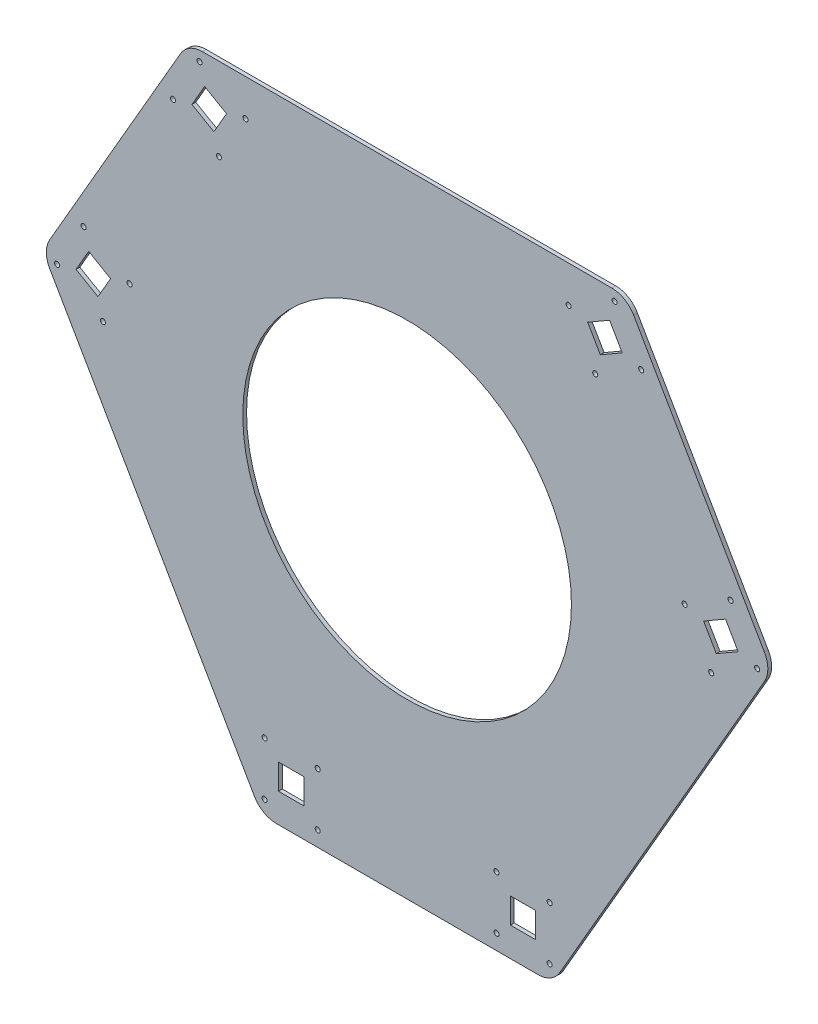
from build123d import *

# Parameters (mm, degrees)
SKETCH_1_R          = 2
SKETCH_1_R_2        = 130
EXTRUDE_1_DEPTH     = 3
SKETCH_8_W          = 20
SKETCH_8_H          = 20
CUT_EXTRUDE_4_DEPTH = 393.831948596
FILLET_2_R          = 20


with BuildPart() as part:
    # 草图1 → 凸台-拉伸1 (new body)
    with BuildSketch(Plane.XY):
        Polygon((288.439380774, 33.739992221), (173.439380774, 232.925835092), (-173.439380774, 232.925835092), (-288.439380774, 33.739992221), (-115, -266.665827313), (115, -266.665827313), align=None)
        with Locations((-112.720943809, -254.665736771)):
            Circle(SKETCH_1_R, mode=Mode.SUBTRACT)
        with Locations((-112.720943809, -212.665736771)):
            Circle(SKETCH_1_R, mode=Mode.SUBTRACT)
        with Locations((-70.720943809, -254.665736771)):
            Circle(SKETCH_1_R, mode=Mode.SUBTRACT)
        with Locations((-70.720943809, -212.665736771)):
            Circle(SKETCH_1_R, mode=Mode.SUBTRACT)
        with Locations((70.720943809, -254.665736771)):
            Circle(SKETCH_1_R, mode=Mode.SUBTRACT)
        with Locations((70.720943809, -212.665736771)):
            Circle(SKETCH_1_R, mode=Mode.SUBTRACT)
        with Locations((112.720943809, -254.665736771)):
            Circle(SKETCH_1_R, mode=Mode.SUBTRACT)
        with Locations((112.720943809, -212.665736771)):
            Circle(SKETCH_1_R, mode=Mode.SUBTRACT)
        with Locations((-240.534402462, 8.713667509)):
            Circle(SKETCH_1_R, mode=Mode.SUBTRACT)
        with Locations((-276.907469421, 29.713667509)):
            Circle(SKETCH_1_R, mode=Mode.SUBTRACT)
        with Locations((-219.534402462, 45.086734468)):
            Circle(SKETCH_1_R, mode=Mode.SUBTRACT)
        with Locations((-255.907469421, 66.086734468)):
            Circle(SKETCH_1_R, mode=Mode.SUBTRACT)
        with Locations((-148.813458654, 167.579002304)):
            Circle(SKETCH_1_R, mode=Mode.SUBTRACT)
        with Locations((-185.186525613, 188.579002304)):
            Circle(SKETCH_1_R, mode=Mode.SUBTRACT)
        with Locations((-164.186525613, 224.952069262)):
            Circle(SKETCH_1_R, mode=Mode.SUBTRACT)
        with Locations((-127.813458654, 203.952069262)):
            Circle(SKETCH_1_R, mode=Mode.SUBTRACT)
        Circle(SKETCH_1_R_2, mode=Mode.SUBTRACT)
        with Locations((240.534402462, 8.713667509)):
            Circle(SKETCH_1_R, mode=Mode.SUBTRACT)
        with Locations((219.534402462, 45.086734468)):
            Circle(SKETCH_1_R, mode=Mode.SUBTRACT)
        with Locations((276.907469421, 29.713667509)):
            Circle(SKETCH_1_R, mode=Mode.SUBTRACT)
        with Locations((255.907469421, 66.086734468)):
            Circle(SKETCH_1_R, mode=Mode.SUBTRACT)
        with Locations((127.813458654, 203.952069262)):
            Circle(SKETCH_1_R, mode=Mode.SUBTRACT)
        with Locations((148.813458654, 167.579002303)):
            Circle(SKETCH_1_R, mode=Mode.SUBTRACT)
        with Locations((185.186525613, 188.579002303)):
            Circle(SKETCH_1_R, mode=Mode.SUBTRACT)
        with Locations((164.186525613, 224.952069262)):
            Circle(SKETCH_1_R, mode=Mode.SUBTRACT)
    extrude(amount=EXTRUDE_1_DEPTH)

    # 草图8 → 切除-拉伸4 (cut, through all)
    with BuildSketch(Plane.XY.offset(3)):
        Polygon((-160.160324583, 209.925835092), (-170.160324583, 192.605327016), (-152.839816507, 182.605327016), (-142.839816507, 199.925835092), align=None)
        Polygon((-251.881268391, 51.060500297), (-261.881268391, 33.739992221), (-244.560760316, 23.739992221), (-234.560760316, 41.060500297), align=None)
        with Locations((-91.720943809, -233.665827313)):
            Rectangle(SKETCH_8_W, SKETCH_8_H)
        with Locations((91.720943809, -233.665827313)):
            Rectangle(SKETCH_8_W, SKETCH_8_H)
        Polygon((261.881268391, 33.739992221), (251.881268391, 51.060500297), (234.560760316, 41.060500297), (244.560760316, 23.739992221), align=None)
        Polygon((160.160324583, 209.925835092), (170.160324583, 192.605327016), (152.839816507, 182.605327016), (142.839816507, 199.925835092), align=None)
    extrude(amount=-CUT_EXTRUDE_4_DEPTH, mode=Mode.SUBTRACT)

    # 圆角2
    fillet_2_edges = [part.edges().sort_by_distance(p)[0] for p in [
        (115, -266.665827313, 1.5),
        (-115, -266.665827313, 1.5),
        (173.439380774, 232.925835092, 1.5),
        (288.439380774, 33.739992221, 1.5),
        (-288.439380774, 33.739992221, 1.5),
        (-173.439380774, 232.925835092, 1.5),
    ]]
    fillet(fillet_2_edges, radius=FILLET_2_R)


solid = part.part
